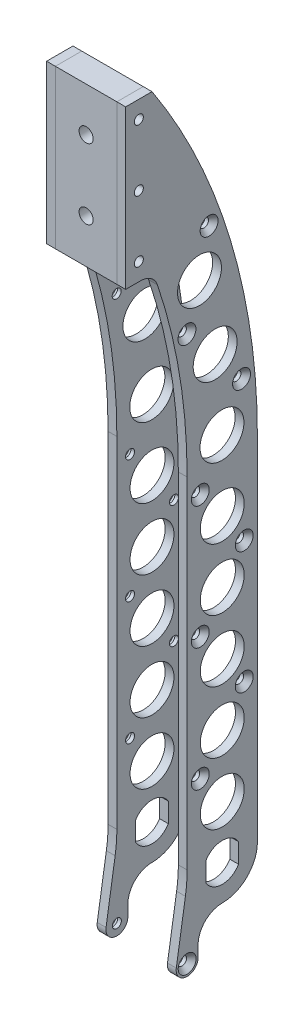
from build123d import *

# Parameters (mm, degrees)
SKETCH1_R                                     = 7.9375
SKETCH1_R_2                                   = 1.5875
SKETCH1_R_3                                   = 1.63195
BOSS_EXTRUDE1_DEPTH                           = 1.5875
SKETCH2_W                                     = 9.525
SKETCH2_H                                     = 57.15
SKETCH2_R                                     = 1.63195
BOSS_EXTRUDE2_DEPTH                           = 22.225
CSK_FOR_4_FLAT_HEAD_SOCKET_CAP_SCREW1_A_COUNT = 2
CSK_FOR_4_FLAT_HEAD_SOCKET_CAP_SCREW1_A_PITCH = 30.978348795
CSK_FOR_4_FLAT_HEAD_SOCKET_CAP_SCRE_2_COUNT   = 2
CSK_FOR_4_FLAT_HEAD_SOCKET_CAP_SCRE_2_PITCH   = 55.073771863
CSK_FOR_4_FLAT_HEAD_SOCKET_CAP_SCRE_3_COUNT   = 2
CSK_FOR_4_FLAT_HEAD_SOCKET_CAP_SCRE_3_PITCH   = 82.68923077
CSK_FOR_4_FLAT_HEAD_SOCKET_CAP_SCRE_4_COUNT   = 2
CSK_FOR_4_FLAT_HEAD_SOCKET_CAP_SCRE_4_PITCH   = 105.619862735
CSK_FOR_4_FLAT_HEAD_SOCKET_CAP_SCRE_5_COUNT   = 2
CSK_FOR_4_FLAT_HEAD_SOCKET_CAP_SCRE_5_PITCH   = 127.117934627
CSK_FOR_4_FLAT_HEAD_SOCKET_CAP_SCRE_6_COUNT   = 2
CSK_FOR_4_FLAT_HEAD_SOCKET_CAP_SCRE_6_PITCH   = 149.589560968
CSK_FOR_4_FLAT_HEAD_SOCKET_CAP_SCRE_7_COUNT   = 2
CSK_FOR_4_FLAT_HEAD_SOCKET_CAP_SCRE_7_PITCH   = 171.55767171
FILLET1_R                                     = 6.35
SKETCH6_W                                     = 2.5527
SKETCH6_H                                     = 47.625
TAP_DRILL_FOR_1_4_20_TAP1_AT_2_COUNT          = 2
TAP_DRILL_FOR_1_4_20_TAP1_AT_2_PITCH          = 25.4
BOSS_EXTRUDE3_START                           = -1.5875
BOSS_EXTRUDE3_DEPTH                           = 3.175
BOSS_EXTRUDE4_START                           = 23.8125
BOSS_EXTRUDE4_DEPTH                           = 3.175


# Read off the part's stored shape, not the designer's step: Boss-Extrude4
with BuildPart() as part:
    # Sketch1 → Boss-Extrude1 (new, symmetric)
    with BuildSketch(Plane(origin=(0, 0, 0), x_dir=(0, 0, -1), z_dir=(1, 0, 0))):
        with BuildLine():
            Line((-12.7, 0), (-12.7, 127))
            ThreePointArc((-12.7, 127), (-15.784916018, 162.457758539), (-24.94696135, 196.85))
            Line((-24.94696135, 196.85), (-34.925, 196.85))
            Line((-34.925, 196.85), (-34.925, 254))
            Line((-34.925, 254), (-25.4, 254))
            ThreePointArc((-25.4, 254), (2.969821105, 193.295946332), (12.7, 127))
            Line((12.7, 127), (12.7, 0))
            ThreePointArc((12.7, 0), (0, -12.7), (-12.7, 0))
        make_face()
        with Locations((0, 19.05)):
            Circle(SKETCH1_R, mode=Mode.SUBTRACT)
        with Locations((0, 41.402)):
            Circle(SKETCH1_R, mode=Mode.SUBTRACT)
        with Locations((0, 63.754)):
            Circle(SKETCH1_R, mode=Mode.SUBTRACT)
        with Locations((0, 86.106)):
            Circle(SKETCH1_R, mode=Mode.SUBTRACT)
        with Locations((0, 108.458)):
            Circle(SKETCH1_R, mode=Mode.SUBTRACT)
        with Locations((-7.9375, 30.1625)):
            Circle(SKETCH1_R_2, mode=Mode.SUBTRACT)
        with Locations((7.9375, 52.6415)):
            Circle(SKETCH1_R_2, mode=Mode.SUBTRACT)
        with Locations((-7.9375, 74.6125)):
            Circle(SKETCH1_R_2, mode=Mode.SUBTRACT)
        with Locations((-7.9375, 119.0625)):
            Circle(SKETCH1_R_2, mode=Mode.SUBTRACT)
        with Locations((-0.107890385, 133.858)):
            Circle(SKETCH1_R, mode=Mode.SUBTRACT)
        with Locations((-2.567929317, 160.363280996)):
            Circle(SKETCH1_R, mode=Mode.SUBTRACT)
        with Locations((-8.239812683, 186.371192317)):
            Circle(SKETCH1_R, mode=Mode.SUBTRACT)
        with Locations((6.970526306, 147.881772727)):
            Circle(SKETCH1_R_2, mode=Mode.SUBTRACT)
        with Locations((-12.761786397, 171.762600381)):
            Circle(SKETCH1_R_2, mode=Mode.SUBTRACT)
        with Locations((-4.7643129, 201.690823043)):
            Circle(SKETCH1_R_2, mode=Mode.SUBTRACT)
        with Locations((-30.1625, 203.2)):
            Circle(SKETCH1_R_3, mode=Mode.SUBTRACT)
        with Locations((-30.1625, 225.425)):
            Circle(SKETCH1_R_3, mode=Mode.SUBTRACT)
        with Locations((7.9375, 96.8375)):
            Circle(SKETCH1_R_2, mode=Mode.SUBTRACT)
        with Locations((-30.1625, 247.65)):
            Circle(SKETCH1_R_3, mode=Mode.SUBTRACT)
        with BuildLine():
            Line((-5.89999963, -3.529253306), (-5.89999963, 3.529253306))
            ThreePointArc((-5.89999963, 3.529253306), (0, 6.874999966), (5.89999963, 3.529253306))
            Line((5.89999963, 3.529253306), (5.89999963, -3.529253306))
            ThreePointArc((5.89999963, -3.529253306), (0, -6.874999966), (-5.89999963, -3.529253306))
        make_face(mode=Mode.SUBTRACT)
    extrude(amount=BOSS_EXTRUDE1_DEPTH, both=True)

    # Sketch4 → CSK for #4 Flat Head Socket Cap Screw1 (revolve, cut)
    with BuildSketch(Plane(origin=(-1.5875, 201.690823043, 4.7643129), x_dir=(0, 0, 1), z_dir=(0, 1, 0))):
        Polygon((0, 0), (0, 25.4), (1.63195, 25.4), (1.63195, 1.848124365), (3.2385, 0), align=None)
    csk_for_4_flat_head_socket_cap_screw1 = revolve(axis=Axis((-7.9375, 201.690823043, 4.7643129), (1, 0, 0)), mode=Mode.SUBTRACT)

    # CSK for #4 Flat Head Socket Cap Screw1 a: CSK for #4 Flat Head Socket Cap Screw1 ×2
    with Locations(*[Vector(0, -0.9661012877208287, 0.2581633240105121) * (i * CSK_FOR_4_FLAT_HEAD_SOCKET_CAP_SCREW1_A_PITCH) for i in range(1, CSK_FOR_4_FLAT_HEAD_SOCKET_CAP_SCREW1_A_COUNT)]):
        add(csk_for_4_flat_head_socket_cap_screw1, mode=Mode.SUBTRACT)

    # CSK for _4 Flat Head Socket Cap Scre 2: CSK for #4 Flat Head Socket Cap Screw1 ×2
    with Locations(*[Vector(0, -0.977035864747747, -0.2130749140481406) * (i * CSK_FOR_4_FLAT_HEAD_SOCKET_CAP_SCRE_2_PITCH) for i in range(1, CSK_FOR_4_FLAT_HEAD_SOCKET_CAP_SCRE_2_COUNT)]):
        add(csk_for_4_flat_head_socket_cap_screw1, mode=Mode.SUBTRACT)

    # CSK for _4 Flat Head Socket Cap Scre 3: CSK for #4 Flat Head Socket Cap Screw1 ×2
    with Locations(*[Vector(0, -0.999263414037656, 0.03837485330015198) * (i * CSK_FOR_4_FLAT_HEAD_SOCKET_CAP_SCRE_3_PITCH) for i in range(1, CSK_FOR_4_FLAT_HEAD_SOCKET_CAP_SCRE_3_COUNT)]):
        add(csk_for_4_flat_head_socket_cap_screw1, mode=Mode.SUBTRACT)

    # CSK for _4 Flat Head Socket Cap Scre 4: CSK for #4 Flat Head Socket Cap Screw1 ×2
    with Locations(*[Vector(0, -0.99274246650338, -0.12025969898842027) * (i * CSK_FOR_4_FLAT_HEAD_SOCKET_CAP_SCRE_4_PITCH) for i in range(1, CSK_FOR_4_FLAT_HEAD_SOCKET_CAP_SCRE_4_COUNT)]):
        add(csk_for_4_flat_head_socket_cap_screw1, mode=Mode.SUBTRACT)

    # CSK for _4 Flat Head Socket Cap Scre 5: CSK for #4 Flat Head Socket Cap Screw1 ×2
    with Locations(*[Vector(0, -0.9996883871346716, 0.024962544503297483) * (i * CSK_FOR_4_FLAT_HEAD_SOCKET_CAP_SCRE_5_PITCH) for i in range(1, CSK_FOR_4_FLAT_HEAD_SOCKET_CAP_SCRE_5_COUNT)]):
        add(csk_for_4_flat_head_socket_cap_screw1, mode=Mode.SUBTRACT)

    # CSK for _4 Flat Head Socket Cap Scre 6: CSK for #4 Flat Head Socket Cap Screw1 ×2
    with Locations(*[Vector(0, -0.9963885319187731, -0.08491109150606914) * (i * CSK_FOR_4_FLAT_HEAD_SOCKET_CAP_SCRE_6_PITCH) for i in range(1, CSK_FOR_4_FLAT_HEAD_SOCKET_CAP_SCRE_6_COUNT)]):
        add(csk_for_4_flat_head_socket_cap_screw1, mode=Mode.SUBTRACT)

    # CSK for _4 Flat Head Socket Cap Scre 7: CSK for #4 Flat Head Socket Cap Screw1 ×2
    with Locations(*[Vector(0, -0.9998289282781047, 0.018496328777812505) * (i * CSK_FOR_4_FLAT_HEAD_SOCKET_CAP_SCRE_7_PITCH) for i in range(1, CSK_FOR_4_FLAT_HEAD_SOCKET_CAP_SCRE_7_COUNT)]):
        add(csk_for_4_flat_head_socket_cap_screw1, mode=Mode.SUBTRACT)

    # Fillet1
    fillet1_edges = [part.edges().sort_by_distance(p)[0] for p in [
        (0, 196.85, 24.94696135),
    ]]
    fillet(fillet1_edges, radius=FILLET1_R)


with BuildPart() as body_2:
    # Sketch2 → Boss-Extrude2 (new body)
    with BuildSketch(Plane(origin=(1.5875, 0, 0), x_dir=(0, 0, -1), z_dir=(1, 0, 0))):
        with Locations((-30.1625, 225.425)):
            Rectangle(SKETCH2_W, SKETCH2_H)
        with Locations((-30.1625, 203.2)):
            Circle(SKETCH2_R, mode=Mode.SUBTRACT)
        with Locations((-30.1625, 225.425)):
            Circle(SKETCH2_R, mode=Mode.SUBTRACT)
        with Locations((-30.1625, 247.65)):
            Circle(SKETCH2_R, mode=Mode.SUBTRACT)
    extrude(amount=BOSS_EXTRUDE2_DEPTH)

    # Sketch6 → Tap Drill for 1/4-20 Tap1 (revolve, cut)
    with BuildSketch(Plane(origin=(12.7, 238.125, 34.925), x_dir=(0, -1, 0), z_dir=(1, 0, 0))):
        with Locations((1.27635, 23.8125)):
            Rectangle(SKETCH6_W, SKETCH6_H)
    tap_drill_for_1_4_20_tap1 = revolve(axis=Axis((12.7, 238.125, 41.275), (0, 0, -1)), mode=Mode.SUBTRACT)

    # Tap Drill for 1/4-20 Tap1 at 2: Tap Drill for 1/4-20 Tap1 ×2
    with Locations(*[(0, -i * TAP_DRILL_FOR_1_4_20_TAP1_AT_2_PITCH, 0) for i in range(1, TAP_DRILL_FOR_1_4_20_TAP1_AT_2_COUNT)]):
        add(tap_drill_for_1_4_20_tap1, mode=Mode.SUBTRACT)


with BuildPart() as body_3:
    # Mirror2: mirrored copy
    add(part.part.mirror(Plane(origin=(12.7, 0, 0), x_dir=(0, 0, 1), z_dir=(1, 0, 0))))

    # Boss-Extrude4 outline → Boss-Extrude4 (add)
    with BuildSketch(Plane.YZ.offset(BOSS_EXTRUDE4_START)):
        with BuildLine():
            Line((-3.944226387, 13.323949002), (-24.779882812, 16.620003984))
            ThreePointArc((-24.779882812, 16.620003984), (-29.356544728, 13.011015072), (-25.4, 8.73125))
            Line((-25.4, 8.73125), (-21.43125, 8.73125))
            ThreePointArc((-21.43125, 8.73125), (-15.257323917, 6.173926083), (-12.7, 0))
            ThreePointArc((-12.7, 0), (-8.980256121, 8.980256121), (0, 12.7))
            Line((0, 12.7), (3.993273613, 12.7))
            ThreePointArc((3.993273613, 12.7), (0.01228069, 12.856227477), (-3.944226387, 13.323949002))
        make_face()
    extrude(amount=BOSS_EXTRUDE4_DEPTH)

    # Sketch11 → CSK for #4 Flat Head Socket Cap Screw3 (revolve, cut)
    with BuildSketch(Plane(origin=(26.9875, -25.4, 12.7), x_dir=(0, 0, -1), z_dir=(0, 1, 0))):
        Polygon((0, 0), (0, 22.570574487), (1.63195, 21.59), (1.63195, 1.848124365), (3.2385, 0), align=None)
    revolve(axis=Axis((33.3375, -25.4, 12.7), (-1, 0, 0)), mode=Mode.SUBTRACT)


with BuildPart() as part_1:
    add(part.part)

    # Sketch7 → Boss-Extrude3 (add)
    with BuildSketch(Plane(origin=(0, 0, 0), x_dir=(0, 0, -1), z_dir=(1, 0, 0)).offset(BOSS_EXTRUDE3_START)):
        with BuildLine():
            ThreePointArc((-13.323949002, -3.944226387), (-12.856227477, 0.01228069), (-12.7, 3.993273613))
            Line((-12.7, 3.993273613), (-12.7, 0))
            ThreePointArc((-12.7, 0), (-8.980256121, -8.980256121), (0, -12.7))
            ThreePointArc((0, -12.7), (-6.173926083, -15.257323917), (-8.73125, -21.43125))
            Line((-8.73125, -21.43125), (-8.73125, -25.4))
            ThreePointArc((-8.73125, -25.4), (-13.011015072, -29.356544728), (-16.620003984, -24.779882812))
            Line((-16.620003984, -24.779882812), (-13.323949002, -3.944226387))
        make_face()
    extrude(amount=BOSS_EXTRUDE3_DEPTH)

    # Sketch9 → CSK for #4 Flat Head Socket Cap Screw2 (revolve, cut)
    with BuildSketch(Plane(origin=(-1.5875, -25.4, 12.7), x_dir=(0, 0, 1), z_dir=(0, 1, 0))):
        Polygon((0, 0), (0, 22.570574487), (1.63195, 21.59), (1.63195, 1.848124365), (3.2385, 0), align=None)
    revolve(axis=Axis((-7.9375, -25.4, 12.7), (1, 0, 0)), mode=Mode.SUBTRACT)


solid = Compound([body_2.part, body_3.part, part_1.part])
